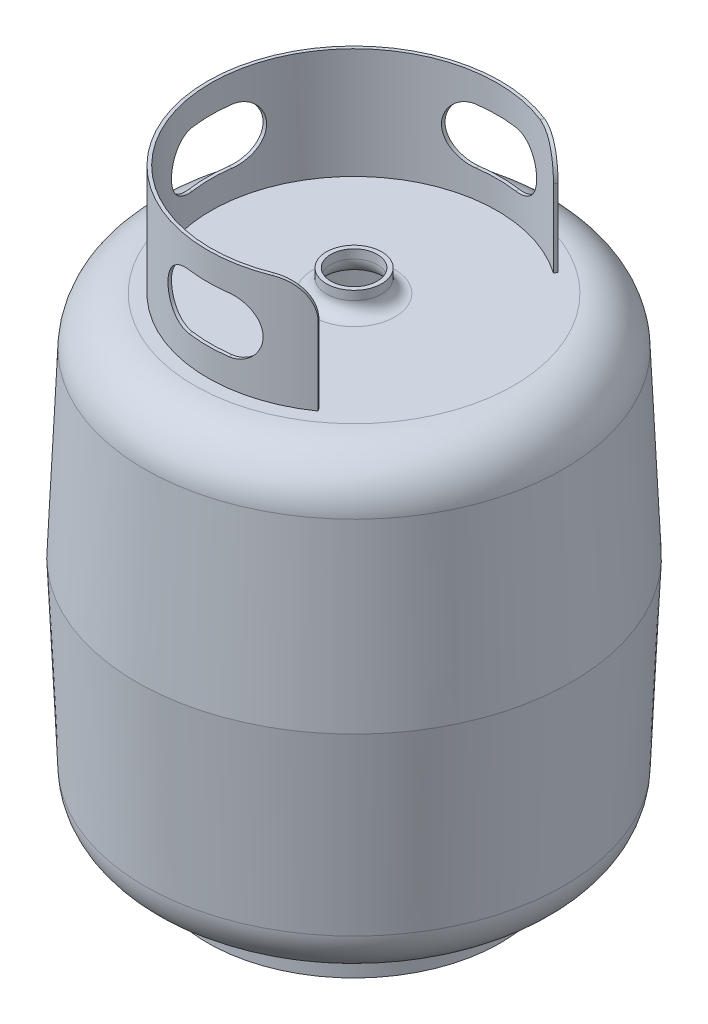
from build123d import *

# Parameters (mm, degrees)
BOSS_EXTRUDE1_DEPTH     = 100
FILLET1_R               = 30
CUT_EXTRUDE1_DEPTH      = 414.542678837
CUT_EXTRUDE1_DEPTH_BACK = 414.542678837
CUT_EXTRUDE2_REACH      = 415.543
CUT_EXTRUDE2_END_RADIUS = 132.421871599
BOSS_EXTRUDE2_START     = 30
SKETCH6_R               = 132.421871599
SKETCH6_R_2             = 129.421871599
BOSS_EXTRUDE2_DEPTH     = 30


# Read off the part's stored shape, not the designer's step: Shell1
with BuildPart() as part:
    # Sketch1 → Revolve1 (revolve)
    with BuildSketch(Plane.XY, mode=Mode.PRIVATE) as revolve1_sk:
        with BuildLine():
            ThreePointArc((25, 218.25), (28.514718626, 209.764718626), (37, 206.25))
            Line((37, 206.25), (144.421871599, 206.25))
            ThreePointArc((144.421871599, 206.25), (175.539959109, 193.756378293), (189.37904157, 163.212872431))
            Line((189.37904157, 163.212872431), (196.505069475, 0))
            Line((196.505069475, 0), (189.37904157, -163.212872431))
            ThreePointArc((189.37904157, -163.212872431), (175.539959109, -193.756378293), (144.421871599, -206.25))
            Line((144.421871599, -206.25), (0, -206.25))
            Line((0, -206.25), (0, 226.25))
            Line((0, 226.25), (25, 226.25))
            Line((25, 226.25), (25, 218.25))
        make_face()
    revolve(revolve1_sk.sketch.rotate(Axis((0, 226.25, 0), (0, -1, 0)), 180), axis=Axis((0, 226.25, 0), (0, -1, 0)))

    # Shell1 outline → Shell1 (revolve, cut)
    with BuildSketch(Plane.XY):
        with BuildLine():
            Line((0, -202.25), (144.421871599, -202.25))
            ThreePointArc((144.421871599, -202.25), (172.773906886, -190.866922444), (185.382848683, -163.038394882))
            Line((185.382848683, -163.038394882), (192.501258734, 0))
            Line((192.501258734, 0), (185.382848683, 163.038394882))
            ThreePointArc((185.382848683, 163.038394882), (172.773906886, 190.866922444), (144.421871599, 202.25))
            Line((144.421871599, 202.25), (37, 202.25))
            ThreePointArc((37, 202.25), (25.686291501, 206.936291501), (21, 218.25))
            Line((21, 218.25), (21, 226.25))
            Line((21, 226.25), (0, 226.25))
            Line((0, 226.25), (0, -202.25))
        make_face()
    revolve(axis=Axis((0, 0, 0), (0, 1, 0)), mode=Mode.SUBTRACT)

    # Sketch3 → Boss-Extrude1 (add)
    with BuildSketch(Plane(origin=(0, 206.25, 0), x_dir=(1, 0, 0), z_dir=(0, 1, 0))):
        with BuildLine():
            Line((75.954065206, 108.473646829), (74.233335897, 106.016190696))
            ThreePointArc((74.233335897, 106.016190696), (-129.421871599, 0), (74.233335897, -106.016190696))
            Line((74.233335897, -106.016190696), (75.954065206, -108.473646829))
            ThreePointArc((75.954065206, -108.473646829), (-132.421871599, 0), (75.954065206, 108.473646829))
        make_face()
    extrude(amount=BOSS_EXTRUDE1_DEPTH)

    # Fillet1
    # the kernel refuses this fillet: 30 mm, written as the material it takes off along each edge
    with BuildSketch(Plane(origin=(31.215103171, 306.25, 44.579787374), x_dir=(0, -1, 0), z_dir=(0.5735764363510424, 0, 0.8191520442889944)), Plane(origin=(118.972297933, 306.25, -169.91005015), x_dir=(0, -1, 0), z_dir=(-0.5735764363510459, 0, 0.8191520442889919))) as fillet1_piece_1:
        with BuildLine():
            CenterArc((FILLET1_R, -FILLET1_R), FILLET1_R, 90, 90)
            Line((0, -FILLET1_R), (0, 0))
            Line((0, 0), (FILLET1_R, 0))
        make_face()
    extrude(amount=153, mode=Mode.SUBTRACT)

    # Sketch4 → Cut-Extrude1 (cut, two sides: drawn at the far end of the back side and taken through both)
    with BuildSketch(Plane.XY.offset(-CUT_EXTRUDE1_DEPTH_BACK)):
        with BuildLine():
            Line((-18, 281.25), (18, 281.25))
            ThreePointArc((18, 281.25), (43, 256.25), (18, 231.25))
            Line((18, 231.25), (-18, 231.25))
            ThreePointArc((-18, 231.25), (-43, 256.25), (-18, 281.25))
        make_face()
    extrude(amount=CUT_EXTRUDE1_DEPTH + CUT_EXTRUDE1_DEPTH_BACK, mode=Mode.SUBTRACT)

    # Cut-Extrude2: up to this cylinder (the profile starts inside it)
    cut_extrude2_end = Plane(origin=(0, 256.25, 0), z_dir=(0, -1, 0)) * Cylinder(CUT_EXTRUDE2_END_RADIUS, 1096.929743197, mode=Mode.PRIVATE)
    # Sketch5 → Cut-Extrude2 (cut, up to the surface)
    with BuildSketch(Plane(origin=(0, 0, 0), x_dir=(0, 0, -1), z_dir=(1, 0, 0)), mode=Mode.PRIVATE) as cut_extrude2_sk1:
        with BuildLine():
            Line((-18, 281.25), (18, 281.25))
            ThreePointArc((18, 281.25), (43, 256.25), (18, 231.25))
            Line((18, 231.25), (-18, 231.25))
            ThreePointArc((-18, 231.25), (-43, 256.25), (-18, 281.25))
        make_face()
    cut_extrude2_tool1 = extrude(cut_extrude2_sk1.sketch, amount=-CUT_EXTRUDE2_REACH, mode=Mode.PRIVATE) & cut_extrude2_end
    add(cut_extrude2_tool1.solids().sort_by_distance((0, 256.25, 0))[0], mode=Mode.SUBTRACT)

    # Sketch6 → Boss-Extrude2 (add)
    with BuildSketch(Plane.XZ.offset(206.25).offset(BOSS_EXTRUDE2_START)):
        with Locations(Location((0, 0, 0), (0, 0, 180))):
            Circle(SKETCH6_R)
        Circle(SKETCH6_R_2, mode=Mode.SUBTRACT)
    extrude(amount=-BOSS_EXTRUDE2_DEPTH)


solid = part.part
